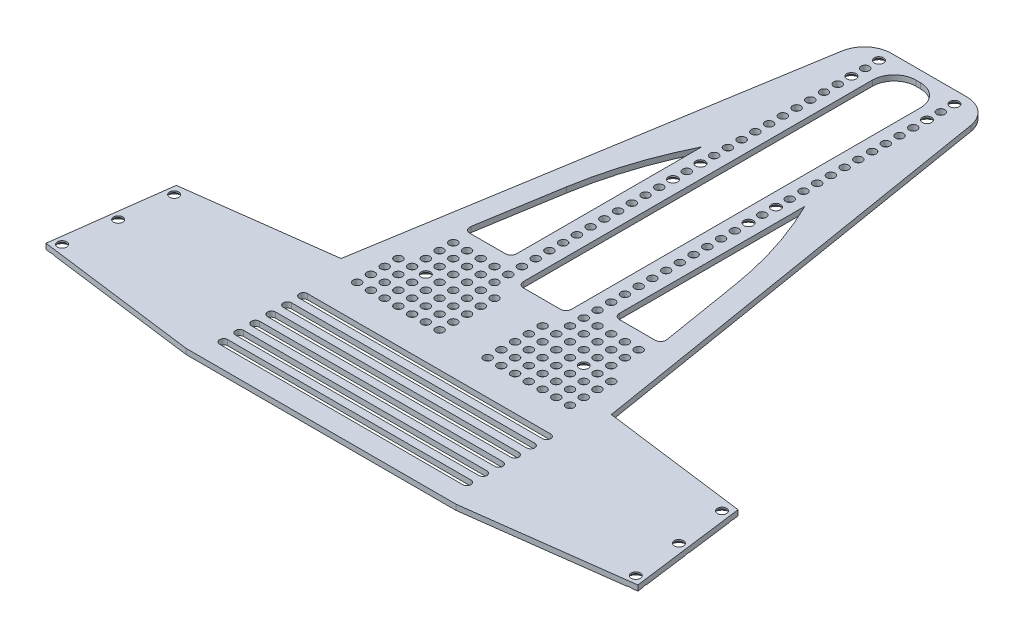
from build123d import *

# Parameters (mm, degrees)
SKETCH_1_R                   = 1.5
EXTRUDE_1_DEPTH              = 2
HOLE_WIZARD_M3_1_AT_2_COUNT  = 2
HOLE_WIZARD_M3_1_AT_2_PITCH  = 27.94
HOLE_WIZARD_M3_1_AT_3_COUNT  = 2
HOLE_WIZARD_M3_1_AT_3_PITCH  = 194.14644553
HOLE_WIZARD_M3_1_AT_4_COUNT  = 2
HOLE_WIZARD_M3_1_AT_4_PITCH  = 211.694573496
HOLE_WIZARD_M3_1_AT_5_COUNT  = 2
HOLE_WIZARD_M3_1_AT_5_PITCH  = 229.392333314
HOLE_WIZARD_M3_1_AT_6_COUNT  = 2
HOLE_WIZARD_M3_1_AT_6_PITCH  = 208.220448443
HOLE_WIZARD_M3_1_AT_7_COUNT  = 2
HOLE_WIZARD_M3_1_AT_7_PITCH  = 224.969703001
HOLE_WIZARD_M3_1_AT_8_COUNT  = 2
HOLE_WIZARD_M3_1_AT_8_PITCH  = 241.974129582
HOLE_WIZARD_M3_1_AT_9_COUNT  = 2
HOLE_WIZARD_M3_1_AT_9_PITCH  = 71.707218605
HOLE_WIZARD_M3_1_AT_10_COUNT = 2
HOLE_WIZARD_M3_1_AT_10_PITCH = 66.04
HOLE_WIZARD_M3_1_AT_11_COUNT = 2
HOLE_WIZARD_M3_1_AT_11_PITCH = 29.729937773
HOLE_WIZARD_M3_1_AT_12_COUNT = 2
HOLE_WIZARD_M3_1_AT_12_PITCH = 10.16
HOLE_WIZARD_M3_1_AT_13_COUNT = 2
HOLE_WIZARD_M3_1_AT_13_PITCH = 81.160850168
HOLE_WIZARD_M3_1_AT_14_COUNT = 2
HOLE_WIZARD_M3_1_AT_14_PITCH = 76.2
HOLE_WIZARD_M3_1_AT_15_COUNT = 2
HOLE_WIZARD_M3_1_AT_15_PITCH = 158.399092169
HOLE_WIZARD_M3_1_AT_16_COUNT = 2
HOLE_WIZARD_M3_1_AT_16_PITCH = 153.160104466


with BuildPart() as part:
    # 스케치1 → 보스-돌출1 (new body)
    with BuildSketch(Plane(origin=(0, 0, 0), x_dir=(1, 0, 0), z_dir=(0, 1, 0))):
        with BuildLine():
            Line((-13.97, 75), (13.97, 75))
            ThreePointArc((13.97, 75), (20.442291372, 72.622955096), (23.8375973, 66.621888879))
            Line((23.8375973, 66.621888879), (50, -92.550578258))
            Line((50, -92.550578258), (103.926881331, -99.592743877))
            Line((103.926881331, -99.592743877), (109.494860266, -142.230727067))
            Line((109.494860266, -142.230727067), (50, -150))
            Line((50, -150), (-50, -150))
            Line((-50, -150), (-109.494860266, -142.230727067))
            Line((-109.494860266, -142.230727067), (-103.926881331, -99.592743877))
            Line((-103.926881331, -99.592743877), (-50, -92.550578258))
            Line((-50, -92.550578258), (-23.8375973, 66.621888879))
            ThreePointArc((-23.8375973, 66.621888879), (-20.442291372, 72.622955096), (-13.97, 75))
        make_face()
        with Locations((-13.97, 65.34)):
            Circle(SKETCH_1_R, mode=Mode.SUBTRACT)
        with Locations((-13.97, 60.26)):
            Circle(SKETCH_1_R, mode=Mode.SUBTRACT)
        with Locations((-13.97, 70.42)):
            Circle(SKETCH_1_R, mode=Mode.SUBTRACT)
        with Locations((-13.97, 55.18)):
            Circle(SKETCH_1_R, mode=Mode.SUBTRACT)
        with Locations((-13.97, 50.1)):
            Circle(SKETCH_1_R, mode=Mode.SUBTRACT)
        with Locations((-13.97, 45.02)):
            Circle(SKETCH_1_R, mode=Mode.SUBTRACT)
        with Locations((-13.97, 39.94)):
            Circle(SKETCH_1_R, mode=Mode.SUBTRACT)
        with Locations((-13.97, 34.86)):
            Circle(SKETCH_1_R, mode=Mode.SUBTRACT)
        with Locations((-13.97, 29.78)):
            Circle(SKETCH_1_R, mode=Mode.SUBTRACT)
        with Locations((-13.97, 24.7)):
            Circle(SKETCH_1_R, mode=Mode.SUBTRACT)
        with Locations((-13.97, 19.62)):
            Circle(SKETCH_1_R, mode=Mode.SUBTRACT)
        with Locations((-13.97, 14.54)):
            Circle(SKETCH_1_R, mode=Mode.SUBTRACT)
        with Locations((-13.97, 9.46)):
            Circle(SKETCH_1_R, mode=Mode.SUBTRACT)
        with Locations((-13.97, 4.38)):
            Circle(SKETCH_1_R, mode=Mode.SUBTRACT)
        with Locations((-13.97, -0.7)):
            Circle(SKETCH_1_R, mode=Mode.SUBTRACT)
        with Locations((-13.97, -5.78)):
            Circle(SKETCH_1_R, mode=Mode.SUBTRACT)
        with Locations((-13.97, -10.86)):
            Circle(SKETCH_1_R, mode=Mode.SUBTRACT)
        with Locations((-13.97, -15.94)):
            Circle(SKETCH_1_R, mode=Mode.SUBTRACT)
        with Locations((-13.97, -21.02)):
            Circle(SKETCH_1_R, mode=Mode.SUBTRACT)
        with Locations((-13.97, -26.1)):
            Circle(SKETCH_1_R, mode=Mode.SUBTRACT)
        with Locations((-13.97, -31.18)):
            Circle(SKETCH_1_R, mode=Mode.SUBTRACT)
        with Locations((-13.97, -36.26)):
            Circle(SKETCH_1_R, mode=Mode.SUBTRACT)
        with Locations((-13.97, -41.34)):
            Circle(SKETCH_1_R, mode=Mode.SUBTRACT)
        with Locations((-13.97, -46.42)):
            Circle(SKETCH_1_R, mode=Mode.SUBTRACT)
        with Locations((-13.97, -51.5)):
            Circle(SKETCH_1_R, mode=Mode.SUBTRACT)
        with Locations((-13.97, -56.58)):
            Circle(SKETCH_1_R, mode=Mode.SUBTRACT)
        with Locations((-13.97, -61.66)):
            Circle(SKETCH_1_R, mode=Mode.SUBTRACT)
        with Locations((-13.97, -66.74)):
            Circle(SKETCH_1_R, mode=Mode.SUBTRACT)
        with Locations((-13.97, -71.82)):
            Circle(SKETCH_1_R, mode=Mode.SUBTRACT)
        with Locations((-13.97, -76.9)):
            Circle(SKETCH_1_R, mode=Mode.SUBTRACT)
        with Locations((-13.97, -81.98)):
            Circle(SKETCH_1_R, mode=Mode.SUBTRACT)
        with Locations((-13.97, -87.06)):
            Circle(SKETCH_1_R, mode=Mode.SUBTRACT)
        with Locations((-13.97, -92.14)):
            Circle(SKETCH_1_R, mode=Mode.SUBTRACT)
        with Locations((-19.05, -66.74)):
            Circle(SKETCH_1_R, mode=Mode.SUBTRACT)
        with Locations((-19.05, -71.82)):
            Circle(SKETCH_1_R, mode=Mode.SUBTRACT)
        with Locations((-19.05, -76.9)):
            Circle(SKETCH_1_R, mode=Mode.SUBTRACT)
        with Locations((-19.05, -81.98)):
            Circle(SKETCH_1_R, mode=Mode.SUBTRACT)
        with Locations((-19.05, -87.06)):
            Circle(SKETCH_1_R, mode=Mode.SUBTRACT)
        with Locations((101.340601965, -102.955950537)):
            Circle(SKETCH_1_R, mode=Mode.SUBTRACT)
        with Locations((-24.13, -66.74)):
            Circle(SKETCH_1_R, mode=Mode.SUBTRACT)
        with Locations((-24.13, -71.82)):
            Circle(SKETCH_1_R, mode=Mode.SUBTRACT)
        with Locations((-24.13, -76.9)):
            Circle(SKETCH_1_R, mode=Mode.SUBTRACT)
        with Locations((-24.13, -81.98)):
            Circle(SKETCH_1_R, mode=Mode.SUBTRACT)
        with Locations((-19.05, -92.14)):
            Circle(SKETCH_1_R, mode=Mode.SUBTRACT)
        with Locations((103.736127785, -121.300199119)):
            Circle(SKETCH_1_R, mode=Mode.SUBTRACT)
        with Locations((-29.21, -66.74)):
            Circle(SKETCH_1_R, mode=Mode.SUBTRACT)
        with Locations((-29.21, -71.82)):
            Circle(SKETCH_1_R, mode=Mode.SUBTRACT)
        with Locations((-29.21, -76.9)):
            Circle(SKETCH_1_R, mode=Mode.SUBTRACT)
        with Locations((-29.21, -81.98)):
            Circle(SKETCH_1_R, mode=Mode.SUBTRACT)
        with Locations((106.131653606, -139.644447701)):
            Circle(SKETCH_1_R, mode=Mode.SUBTRACT)
        with Locations((-8.89, -76.9)):
            Circle(SKETCH_1_R, mode=Mode.SUBTRACT)
        with Locations((-34.29, -66.74)):
            Circle(SKETCH_1_R, mode=Mode.SUBTRACT)
        with Locations((-34.29, -71.82)):
            Circle(SKETCH_1_R, mode=Mode.SUBTRACT)
        with Locations((-34.29, -76.9)):
            Circle(SKETCH_1_R, mode=Mode.SUBTRACT)
        with Locations((-8.89, -81.98)):
            Circle(SKETCH_1_R, mode=Mode.SUBTRACT)
        with Locations((-8.89, -87.06)):
            Circle(SKETCH_1_R, mode=Mode.SUBTRACT)
        with Locations((-8.89, -92.14)):
            Circle(SKETCH_1_R, mode=Mode.SUBTRACT)
        with Locations((-24.13, -87.06)):
            Circle(SKETCH_1_R, mode=Mode.SUBTRACT)
        with Locations((-24.13, -92.14)):
            Circle(SKETCH_1_R, mode=Mode.SUBTRACT)
        with Locations((-29.21, -87.06)):
            Circle(SKETCH_1_R, mode=Mode.SUBTRACT)
        with Locations((-29.21, -92.14)):
            Circle(SKETCH_1_R, mode=Mode.SUBTRACT)
        with Locations((-34.29, -87.06)):
            Circle(SKETCH_1_R, mode=Mode.SUBTRACT)
        with Locations((13.97, 39.94)):
            Circle(SKETCH_1_R, mode=Mode.SUBTRACT)
        with Locations((13.97, 45.02)):
            Circle(SKETCH_1_R, mode=Mode.SUBTRACT)
        with Locations((13.97, 50.1)):
            Circle(SKETCH_1_R, mode=Mode.SUBTRACT)
        with Locations((13.97, 55.18)):
            Circle(SKETCH_1_R, mode=Mode.SUBTRACT)
        with Locations((13.97, 70.42)):
            Circle(SKETCH_1_R, mode=Mode.SUBTRACT)
        with Locations((13.97, 60.26)):
            Circle(SKETCH_1_R, mode=Mode.SUBTRACT)
        with Locations((13.97, 65.34)):
            Circle(SKETCH_1_R, mode=Mode.SUBTRACT)
        with Locations((13.97, -41.34)):
            Circle(SKETCH_1_R, mode=Mode.SUBTRACT)
        with Locations((13.97, -36.26)):
            Circle(SKETCH_1_R, mode=Mode.SUBTRACT)
        with Locations((13.97, -31.18)):
            Circle(SKETCH_1_R, mode=Mode.SUBTRACT)
        with Locations((13.97, -26.1)):
            Circle(SKETCH_1_R, mode=Mode.SUBTRACT)
        with Locations((13.97, -21.02)):
            Circle(SKETCH_1_R, mode=Mode.SUBTRACT)
        with Locations((13.97, -15.94)):
            Circle(SKETCH_1_R, mode=Mode.SUBTRACT)
        with Locations((13.97, -10.86)):
            Circle(SKETCH_1_R, mode=Mode.SUBTRACT)
        with Locations((13.97, -5.78)):
            Circle(SKETCH_1_R, mode=Mode.SUBTRACT)
        with Locations((13.97, -0.7)):
            Circle(SKETCH_1_R, mode=Mode.SUBTRACT)
        with Locations((13.97, 4.38)):
            Circle(SKETCH_1_R, mode=Mode.SUBTRACT)
        with Locations((-106.131653606, -139.644447701)):
            Circle(SKETCH_1_R, mode=Mode.SUBTRACT)
        with Locations((-101.340601965, -102.955950537)):
            Circle(SKETCH_1_R, mode=Mode.SUBTRACT)
        with Locations((-103.736127785, -121.300199119)):
            Circle(SKETCH_1_R, mode=Mode.SUBTRACT)
        with Locations((-34.29, -92.14)):
            Circle(SKETCH_1_R, mode=Mode.SUBTRACT)
        with Locations((-39.37, -87.06)):
            Circle(SKETCH_1_R, mode=Mode.SUBTRACT)
        with Locations((-39.37, -92.14)):
            Circle(SKETCH_1_R, mode=Mode.SUBTRACT)
        with Locations((13.97, 9.46)):
            Circle(SKETCH_1_R, mode=Mode.SUBTRACT)
        with Locations((13.97, 14.54)):
            Circle(SKETCH_1_R, mode=Mode.SUBTRACT)
        with Locations((-39.37, -81.98)):
            Circle(SKETCH_1_R, mode=Mode.SUBTRACT)
        with Locations((-13.97, -97.22)):
            Circle(SKETCH_1_R, mode=Mode.SUBTRACT)
        with Locations((13.97, 19.62)):
            Circle(SKETCH_1_R, mode=Mode.SUBTRACT)
        with Locations((13.97, 24.7)):
            Circle(SKETCH_1_R, mode=Mode.SUBTRACT)
        with Locations((13.97, 29.78)):
            Circle(SKETCH_1_R, mode=Mode.SUBTRACT)
        with Locations((13.97, 34.86)):
            Circle(SKETCH_1_R, mode=Mode.SUBTRACT)
        with Locations((13.97, -66.74)):
            Circle(SKETCH_1_R, mode=Mode.SUBTRACT)
        with Locations((34.29, -66.74)):
            Circle(SKETCH_1_R, mode=Mode.SUBTRACT)
        with Locations((29.21, -66.74)):
            Circle(SKETCH_1_R, mode=Mode.SUBTRACT)
        with Locations((24.13, -66.74)):
            Circle(SKETCH_1_R, mode=Mode.SUBTRACT)
        with Locations((19.05, -66.74)):
            Circle(SKETCH_1_R, mode=Mode.SUBTRACT)
        with Locations((13.97, -61.66)):
            Circle(SKETCH_1_R, mode=Mode.SUBTRACT)
        with Locations((13.97, -56.58)):
            Circle(SKETCH_1_R, mode=Mode.SUBTRACT)
        with Locations((13.97, -51.5)):
            Circle(SKETCH_1_R, mode=Mode.SUBTRACT)
        with Locations((13.97, -46.42)):
            Circle(SKETCH_1_R, mode=Mode.SUBTRACT)
        with Locations((-19.05, -97.22)):
            Circle(SKETCH_1_R, mode=Mode.SUBTRACT)
        with Locations((-8.89, -97.22)):
            Circle(SKETCH_1_R, mode=Mode.SUBTRACT)
        with Locations((-24.13, -97.22)):
            Circle(SKETCH_1_R, mode=Mode.SUBTRACT)
        with Locations((-29.21, -97.22)):
            Circle(SKETCH_1_R, mode=Mode.SUBTRACT)
        with Locations((-34.29, -97.22)):
            Circle(SKETCH_1_R, mode=Mode.SUBTRACT)
        with Locations((8.89, -92.14)):
            Circle(SKETCH_1_R, mode=Mode.SUBTRACT)
        with Locations((8.89, -87.06)):
            Circle(SKETCH_1_R, mode=Mode.SUBTRACT)
        with Locations((8.89, -81.98)):
            Circle(SKETCH_1_R, mode=Mode.SUBTRACT)
        with Locations((34.29, -76.9)):
            Circle(SKETCH_1_R, mode=Mode.SUBTRACT)
        with Locations((34.29, -71.82)):
            Circle(SKETCH_1_R, mode=Mode.SUBTRACT)
        with Locations((8.89, -76.9)):
            Circle(SKETCH_1_R, mode=Mode.SUBTRACT)
        with Locations((-39.37, -97.22)):
            Circle(SKETCH_1_R, mode=Mode.SUBTRACT)
        with Locations((8.89, -97.22)):
            Circle(SKETCH_1_R, mode=Mode.SUBTRACT)
        with Locations((29.21, -76.9)):
            Circle(SKETCH_1_R, mode=Mode.SUBTRACT)
        with Locations((29.21, -71.82)):
            Circle(SKETCH_1_R, mode=Mode.SUBTRACT)
        with Locations((39.37, -81.98)):
            Circle(SKETCH_1_R, mode=Mode.SUBTRACT)
        with Locations((39.37, -97.22)):
            Circle(SKETCH_1_R, mode=Mode.SUBTRACT)
        with Locations((24.13, -81.98)):
            Circle(SKETCH_1_R, mode=Mode.SUBTRACT)
        with Locations((24.13, -76.9)):
            Circle(SKETCH_1_R, mode=Mode.SUBTRACT)
        with Locations((24.13, -71.82)):
            Circle(SKETCH_1_R, mode=Mode.SUBTRACT)
        with Locations((34.29, -97.22)):
            Circle(SKETCH_1_R, mode=Mode.SUBTRACT)
        with Locations((29.21, -97.22)):
            Circle(SKETCH_1_R, mode=Mode.SUBTRACT)
        with Locations((19.05, -81.98)):
            Circle(SKETCH_1_R, mode=Mode.SUBTRACT)
        with Locations((19.05, -76.9)):
            Circle(SKETCH_1_R, mode=Mode.SUBTRACT)
        with Locations((19.05, -71.82)):
            Circle(SKETCH_1_R, mode=Mode.SUBTRACT)
        with Locations((24.13, -97.22)):
            Circle(SKETCH_1_R, mode=Mode.SUBTRACT)
        with Locations((19.05, -97.22)):
            Circle(SKETCH_1_R, mode=Mode.SUBTRACT)
        with Locations((13.97, -81.98)):
            Circle(SKETCH_1_R, mode=Mode.SUBTRACT)
        with Locations((13.97, -76.9)):
            Circle(SKETCH_1_R, mode=Mode.SUBTRACT)
        with Locations((13.97, -71.82)):
            Circle(SKETCH_1_R, mode=Mode.SUBTRACT)
        with Locations((13.97, -97.22)):
            Circle(SKETCH_1_R, mode=Mode.SUBTRACT)
        with Locations((39.37, -92.14)):
            Circle(SKETCH_1_R, mode=Mode.SUBTRACT)
        with Locations((-34.29, -81.98)):
            Circle(SKETCH_1_R, mode=Mode.SUBTRACT)
        with Locations((39.37, -87.06)):
            Circle(SKETCH_1_R, mode=Mode.SUBTRACT)
        with Locations((34.29, -92.14)):
            Circle(SKETCH_1_R, mode=Mode.SUBTRACT)
        with Locations((34.29, -87.06)):
            Circle(SKETCH_1_R, mode=Mode.SUBTRACT)
        with Locations((34.29, -81.98)):
            Circle(SKETCH_1_R, mode=Mode.SUBTRACT)
        with Locations((29.21, -92.14)):
            Circle(SKETCH_1_R, mode=Mode.SUBTRACT)
        with Locations((29.21, -87.06)):
            Circle(SKETCH_1_R, mode=Mode.SUBTRACT)
        with Locations((29.21, -81.98)):
            Circle(SKETCH_1_R, mode=Mode.SUBTRACT)
        with Locations((24.13, -92.14)):
            Circle(SKETCH_1_R, mode=Mode.SUBTRACT)
        with Locations((24.13, -87.06)):
            Circle(SKETCH_1_R, mode=Mode.SUBTRACT)
        with Locations((19.05, -92.14)):
            Circle(SKETCH_1_R, mode=Mode.SUBTRACT)
        with Locations((19.05, -87.06)):
            Circle(SKETCH_1_R, mode=Mode.SUBTRACT)
        with Locations((13.97, -92.14)):
            Circle(SKETCH_1_R, mode=Mode.SUBTRACT)
        with Locations((13.97, -87.06)):
            Circle(SKETCH_1_R, mode=Mode.SUBTRACT)
        with BuildLine():
            Line((-0.890580049, 70.966353468), (0.889419951, 70.966353468))
            ThreePointArc((0.889419951, 70.966353468), (6.546649167, 68.623412813), (8.89, 62.966353489))
            Line((8.89, 62.966353489), (8.89, -66.24))
            ThreePointArc((8.89, -66.24), (8.304213562, -67.654213562), (6.89, -68.24))
            Line((6.89, -68.24), (-6.89, -68.24))
            ThreePointArc((-6.89, -68.24), (-8.304213562, -67.654213562), (-8.89, -66.24))
            Line((-8.89, -66.24), (-8.89, 62.966353489))
            ThreePointArc((-8.89, 62.966353489), (-6.547059324, 68.623002657), (-0.890580049, 70.966353468))
        make_face(mode=Mode.SUBTRACT)
        with BuildLine():
            Line((36.26351946, -58.302819972), (31.255510592, -27.834015706))
            ThreePointArc((31.255510592, -27.834015706), (26.566181646, -8.461026907), (19.05, 10))
            Line((19.05, 10), (19.05, -58.627197748))
            ThreePointArc((19.05, -58.627197748), (19.635786438, -60.04141131), (21.05, -60.627197748))
            Line((21.05, -60.627197748), (34.29, -60.627197748))
            ThreePointArc((34.29, -60.627197748), (35.814591019, -59.921656022), (36.26351946, -58.302819972))
        make_face(mode=Mode.SUBTRACT)
        with BuildLine():
            Line((-19.05, 10), (-19.05, -58.627197748))
            ThreePointArc((-19.05, -58.627197748), (-19.635786438, -60.04141131), (-21.05, -60.627197748))
            Line((-21.05, -60.627197748), (-34.29, -60.627197748))
            ThreePointArc((-34.29, -60.627197748), (-35.814591019, -59.921656022), (-36.26351946, -58.302819972))
            Line((-36.26351946, -58.302819972), (-31.255510592, -27.834015706))
            ThreePointArc((-31.255510592, -27.834015706), (-26.566181646, -8.461026907), (-19.05, 10))
        make_face(mode=Mode.SUBTRACT)
        with BuildLine():
            Line((-45.018395458, -136.599971769), (44.981604542, -136.599971769))
            ThreePointArc((44.981604542, -136.599971769), (46.499971769, -135.118395458), (45.018395458, -133.600028231))
            Line((45.018395458, -133.600028231), (-44.981604542, -133.600028231))
            ThreePointArc((-44.981604542, -133.600028231), (-46.499971769, -135.081604542), (-45.018395458, -136.599971769))
        make_face(mode=Mode.SUBTRACT)
        with BuildLine():
            Line((-45.018395458, -142.499971769), (44.981604542, -142.499971769))
            ThreePointArc((44.981604542, -142.499971769), (46.499971769, -141.018395458), (45.018395458, -139.500028231))
            Line((45.018395458, -139.500028231), (-44.981604542, -139.500028231))
            ThreePointArc((-44.981604542, -139.500028231), (-46.499971769, -140.981604542), (-45.018395458, -142.499971769))
        make_face(mode=Mode.SUBTRACT)
        with BuildLine():
            Line((-45.018395458, -130.699971769), (44.981604542, -130.699971769))
            ThreePointArc((44.981604542, -130.699971769), (46.499971769, -129.218395458), (45.018395458, -127.700028231))
            Line((45.018395458, -127.700028231), (-44.981604542, -127.700028231))
            ThreePointArc((-44.981604542, -127.700028231), (-46.499971769, -129.181604542), (-45.018395458, -130.699971769))
        make_face(mode=Mode.SUBTRACT)
        with BuildLine():
            Line((-45.018395458, -124.799971769), (44.981604542, -124.799971769))
            ThreePointArc((44.981604542, -124.799971769), (46.499971769, -123.318395458), (45.018395458, -121.800028231))
            Line((45.018395458, -121.800028231), (-44.981604542, -121.800028231))
            ThreePointArc((-44.981604542, -121.800028231), (-46.499971769, -123.281604542), (-45.018395458, -124.799971769))
        make_face(mode=Mode.SUBTRACT)
        with BuildLine():
            Line((-45.018395458, -118.899971769), (44.981604542, -118.899971769))
            ThreePointArc((44.981604542, -118.899971769), (46.499971769, -117.418395458), (45.018395458, -115.900028231))
            Line((45.018395458, -115.900028231), (-44.981604542, -115.900028231))
            ThreePointArc((-44.981604542, -115.900028231), (-46.499971769, -117.381604542), (-45.018395458, -118.899971769))
        make_face(mode=Mode.SUBTRACT)
        with BuildLine():
            Line((-45.018395458, -112.999971769), (44.981604542, -112.999971769))
            ThreePointArc((44.981604542, -112.999971769), (46.499971769, -111.518395458), (45.018395458, -110.000028231))
            Line((45.018395458, -110.000028231), (-44.981604542, -110.000028231))
            ThreePointArc((-44.981604542, -110.000028231), (-46.499971769, -111.481604542), (-45.018395458, -112.999971769))
        make_face(mode=Mode.SUBTRACT)
    extrude(amount=EXTRUDE_1_DEPTH)

    # 스케치2 → M3 접시 머리 나사용 카운터싱크1 (revolve, cut)
    with BuildSketch(Plane(origin=(13.97, 0, -70.42), x_dir=(0, 0, -1), z_dir=(1, 0, 0))):
        Polygon((0, 0), (0, 2), (1.7, 2), (1.7, 1.45), (3.15, 0), align=None)
    hole_wizard_m3_1 = revolve(axis=Axis((13.97, -6.35, -70.42), (0, 1, 0)), mode=Mode.SUBTRACT)

    # M3 접시 머리 나사용 카운터싱크1 at 2: M3 접시 머리 나사용 카운터싱크1 ×2
    with Locations(*[(-i * HOLE_WIZARD_M3_1_AT_2_PITCH, 0, 0) for i in range(1, HOLE_WIZARD_M3_1_AT_2_COUNT)]):
        add(hole_wizard_m3_1, mode=Mode.SUBTRACT)

    # M3 접시 머리 나사용 카운터싱크1 at 3: M3 접시 머리 나사용 카운터싱크1 ×2
    with Locations(*[Vector(0.4500242161314282, 0, 0.8930163519753116) * (i * HOLE_WIZARD_M3_1_AT_3_PITCH) for i in range(1, HOLE_WIZARD_M3_1_AT_3_COUNT)]):
        add(hole_wizard_m3_1, mode=Mode.SUBTRACT)

    # M3 접시 머리 나사용 카운터싱크1 at 4: M3 접시 머리 나사용 카운터싱크1 ×2
    with Locations(*[Vector(0.4240360359878779, 0, 0.9056453169887686) * (i * HOLE_WIZARD_M3_1_AT_4_PITCH) for i in range(1, HOLE_WIZARD_M3_1_AT_4_COUNT)]):
        add(hole_wizard_m3_1, mode=Mode.SUBTRACT)

    # M3 접시 머리 나사용 카운터싱크1 at 5: M3 접시 머리 나사용 카운터싱크1 ×2
    with Locations(*[Vector(0.4017643147651559, 0, 0.9157431055603339) * (i * HOLE_WIZARD_M3_1_AT_5_PITCH) for i in range(1, HOLE_WIZARD_M3_1_AT_5_COUNT)]):
        add(hole_wizard_m3_1, mode=Mode.SUBTRACT)

    # M3 접시 머리 나사용 카운터싱크1 at 6: M3 접시 머리 나사용 카운터싱크1 ×2
    with Locations(*[Vector(-0.5537909596616948, 0, 0.8326557349811381) * (i * HOLE_WIZARD_M3_1_AT_6_PITCH) for i in range(1, HOLE_WIZARD_M3_1_AT_6_COUNT)]):
        add(hole_wizard_m3_1, mode=Mode.SUBTRACT)

    # M3 접시 머리 나사용 카운터싱크1 at 7: M3 접시 머리 나사용 카운터싱크1 ×2
    with Locations(*[Vector(-0.5232087975194014, 0, 0.8522045260372079) * (i * HOLE_WIZARD_M3_1_AT_7_PITCH) for i in range(1, HOLE_WIZARD_M3_1_AT_7_COUNT)]):
        add(hole_wizard_m3_1, mode=Mode.SUBTRACT)

    # M3 접시 머리 나사용 카운터싱크1 at 8: M3 접시 머리 나사용 카운터싱크1 ×2
    with Locations(*[Vector(-0.4963408849283133, 0, 0.868127712925108) * (i * HOLE_WIZARD_M3_1_AT_8_PITCH) for i in range(1, HOLE_WIZARD_M3_1_AT_8_COUNT)]):
        add(hole_wizard_m3_1, mode=Mode.SUBTRACT)

    # M3 접시 머리 나사용 카운터싱크1 at 9: M3 접시 머리 나사용 카운터싱크1 ×2
    with Locations(*[Vector(-0.3896399908367058, 0, 0.9209672510685556) * (i * HOLE_WIZARD_M3_1_AT_9_PITCH) for i in range(1, HOLE_WIZARD_M3_1_AT_9_COUNT)]):
        add(hole_wizard_m3_1, mode=Mode.SUBTRACT)

    # M3 접시 머리 나사용 카운터싱크1 at 10: M3 접시 머리 나사용 카운터싱크1 ×2
    with Locations(*[(0, 0, i * HOLE_WIZARD_M3_1_AT_10_PITCH) for i in range(1, HOLE_WIZARD_M3_1_AT_10_COUNT)]):
        add(hole_wizard_m3_1, mode=Mode.SUBTRACT)

    # M3 접시 머리 나사용 카운터싱크1 at 11: M3 접시 머리 나사용 카운터싱크1 ×2
    with Locations(*[Vector(-0.9397934234884396, 0, 0.34174306308669744) * (i * HOLE_WIZARD_M3_1_AT_11_PITCH) for i in range(1, HOLE_WIZARD_M3_1_AT_11_COUNT)]):
        add(hole_wizard_m3_1, mode=Mode.SUBTRACT)

    # M3 접시 머리 나사용 카운터싱크1 at 12: M3 접시 머리 나사용 카운터싱크1 ×2
    with Locations(*[(0, 0, i * HOLE_WIZARD_M3_1_AT_12_PITCH) for i in range(1, HOLE_WIZARD_M3_1_AT_12_COUNT)]):
        add(hole_wizard_m3_1, mode=Mode.SUBTRACT)

    # M3 접시 머리 나사용 카운터싱크1 at 13: M3 접시 머리 나사용 카운터싱크1 ×2
    with Locations(*[Vector(-0.3442546491584304, 0, 0.938876315886606) * (i * HOLE_WIZARD_M3_1_AT_13_PITCH) for i in range(1, HOLE_WIZARD_M3_1_AT_13_COUNT)]):
        add(hole_wizard_m3_1, mode=Mode.SUBTRACT)

    # M3 접시 머리 나사용 카운터싱크1 at 14: M3 접시 머리 나사용 카운터싱크1 ×2
    with Locations(*[(0, 0, i * HOLE_WIZARD_M3_1_AT_14_PITCH) for i in range(1, HOLE_WIZARD_M3_1_AT_14_COUNT)]):
        add(hole_wizard_m3_1, mode=Mode.SUBTRACT)

    # M3 접시 머리 나사용 카운터싱크1 at 15: M3 접시 머리 나사용 카운터싱크1 ×2
    with Locations(*[Vector(-0.27260257245602926, 0, 0.9621267263153828) * (i * HOLE_WIZARD_M3_1_AT_15_PITCH) for i in range(1, HOLE_WIZARD_M3_1_AT_15_COUNT)]):
        add(hole_wizard_m3_1, mode=Mode.SUBTRACT)

    # M3 접시 머리 나사용 카운터싱크1 at 16: M3 접시 머리 나사용 카운터싱크1 ×2
    with Locations(*[Vector(0.09950371902099894, 0, 0.9950371902099892) * (i * HOLE_WIZARD_M3_1_AT_16_PITCH) for i in range(1, HOLE_WIZARD_M3_1_AT_16_COUNT)]):
        add(hole_wizard_m3_1, mode=Mode.SUBTRACT)


solid = part.part
